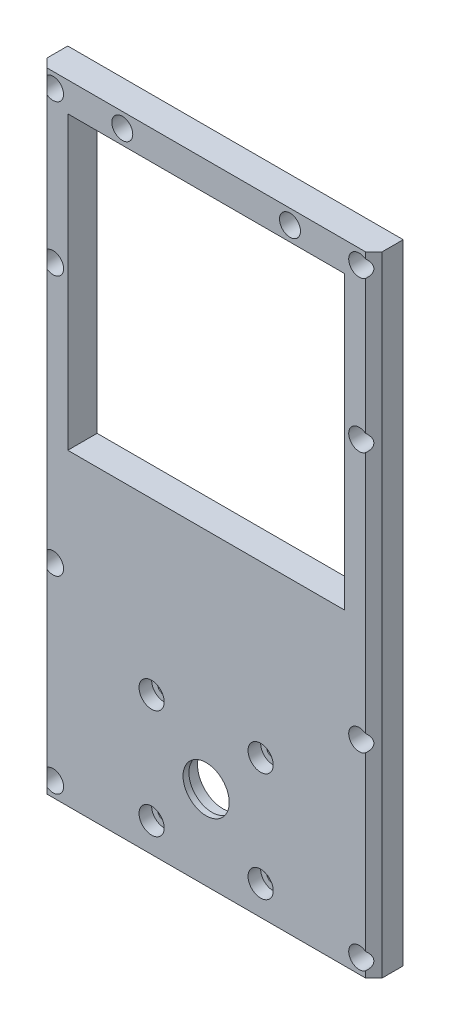
from build123d import *

# Parameters (mm, degrees)
SKETCH1_W           = 80
SKETCH1_H           = 150
SKETCH1_W_2         = 66
SKETCH1_H_2         = 136
BOSS_EXTRUDE1_DEPTH = 7
SKETCH2_W           = 66
SKETCH2_H           = 36
BOSS_EXTRUDE2_DEPTH = 7
SKETCH3_R           = 5.5
CUT_EXTRUDE1_DEPTH  = 86.287748241
SKETCH4_R           = 6.05
CUT_EXTRUDE2_DEPTH  = 5.6
SKETCH5_R           = 11
CUT_EXTRUDE3_DEPTH  = 3
SKETCH6_R           = 1.6
CUT_EXTRUDE4_DEPTH  = 86.287748241
SKETCH7_W           = 50
SKETCH7_H           = 38
CUT_EXTRUDE5_DEPTH  = 1
SKETCH8_R           = 3
CUT_EXTRUDE6_DEPTH  = 3
SKETCH9_R           = 1.35
CUT_EXTRUDE7_DEPTH  = 86.287748241
SKETCH10_R          = 2.5
CUT_EXTRUDE8_DEPTH  = 5
CHAMFER1_SIZE       = 2
SKETCH11_W          = 66
SKETCH11_H          = 30.5
BOSS_EXTRUDE3_DEPTH = 7
SKETCH12_R          = 1.35
CUT_EXTRUDE9_DEPTH  = 86.287748241
SKETCH13_R          = 2.5
CUT_EXTRUDE10_DEPTH = 5


with BuildPart() as part:
    # Sketch1 → Boss-Extrude1 (new body)
    with BuildSketch(Plane.XY):
        Rectangle(SKETCH1_W, SKETCH1_H)
        Rectangle(SKETCH1_W_2, SKETCH1_H_2, mode=Mode.SUBTRACT)
    extrude(amount=BOSS_EXTRUDE1_DEPTH)

    # Sketch2 → Boss-Extrude2 (add)
    with BuildSketch(Plane.XY.offset(7)):
        with Locations((0, -50)):
            Rectangle(SKETCH2_W, SKETCH2_H)
    extrude(amount=-BOSS_EXTRUDE2_DEPTH)

    # Sketch3 → Cut-Extrude1 (cut, through all)
    with BuildSketch(Plane(origin=(0, 0, 0), x_dir=(-1, 0, 0), z_dir=(0, 0, -1))):
        with Locations((0, -55)):
            Circle(SKETCH3_R)
    extrude(amount=-CUT_EXTRUDE1_DEPTH, mode=Mode.SUBTRACT)

    # Sketch4 → Cut-Extrude2 (cut)
    with BuildSketch(Plane(origin=(0, 0, 0), x_dir=(-1, 0, 0), z_dir=(0, 0, -1))):
        with Locations((0, -55)):
            Circle(SKETCH4_R)
    extrude(amount=-CUT_EXTRUDE2_DEPTH, mode=Mode.SUBTRACT)

    # Sketch5 → Cut-Extrude3 (cut)
    with BuildSketch(Plane(origin=(0, 0, 0), x_dir=(-1, 0, 0), z_dir=(0, 0, -1))):
        with Locations((0, -55)):
            Circle(SKETCH5_R)
    extrude(amount=-CUT_EXTRUDE3_DEPTH, mode=Mode.SUBTRACT)

    # Sketch6 → Cut-Extrude4 (cut, through all)
    with BuildSketch(Plane(origin=(0, 0, 0), x_dir=(-1, 0, 0), z_dir=(0, 0, -1))):
        with Locations((-13, -42)):
            Circle(SKETCH6_R)
        with Locations((13, -42)):
            Circle(SKETCH6_R)
        with Locations((13, -68)):
            Circle(SKETCH6_R)
        with Locations((-13, -68)):
            Circle(SKETCH6_R)
    extrude(amount=-CUT_EXTRUDE4_DEPTH, mode=Mode.SUBTRACT)

    # Sketch7 → Cut-Extrude5 (cut)
    with BuildSketch(Plane(origin=(0, 0, 0), x_dir=(-1, 0, 0), z_dir=(0, 0, -1))):
        with Locations((0, -55)):
            Rectangle(SKETCH7_W, SKETCH7_H)
    extrude(amount=-CUT_EXTRUDE5_DEPTH, mode=Mode.SUBTRACT)

    # Sketch8 → Cut-Extrude6 (cut)
    with BuildSketch(Plane.XY.offset(7)):
        with Locations((-13, -42)):
            Circle(SKETCH8_R)
        with Locations((13, -42)):
            Circle(SKETCH8_R)
        with Locations((13, -68)):
            Circle(SKETCH8_R)
        with Locations((-13, -68)):
            Circle(SKETCH8_R)
    extrude(amount=-CUT_EXTRUDE6_DEPTH, mode=Mode.SUBTRACT)

    # Sketch9 → Cut-Extrude7 (cut, through all)
    with BuildSketch(Plane.XY.offset(7)):
        with Locations((-36.5, 71.5)):
            Circle(SKETCH9_R)
        with Locations((36.5, 71.5)):
            Circle(SKETCH9_R)
        with Locations((-36.5, -71.5)):
            Circle(SKETCH9_R)
        with Locations((36.5, -71.5)):
            Circle(SKETCH9_R)
        with Locations((-36.5, 35.5)):
            Circle(SKETCH9_R)
        with Locations((36.5, 35.5)):
            Circle(SKETCH9_R)
        with Locations((36.5, -26.5)):
            Circle(SKETCH9_R)
        with Locations((-36.5, -26.5)):
            Circle(SKETCH9_R)
    extrude(amount=-CUT_EXTRUDE7_DEPTH, mode=Mode.SUBTRACT)

    # Sketch10 → Cut-Extrude8 (cut)
    with BuildSketch(Plane.XY.offset(7)):
        with Locations((-36.5, 71.5)):
            Circle(SKETCH10_R)
        with Locations((36.5, 35.5)):
            Circle(SKETCH10_R)
        with Locations((-36.5, 35.5)):
            Circle(SKETCH10_R)
        with Locations((36.5, 71.5)):
            Circle(SKETCH10_R)
        with Locations((-36.5, -71.5)):
            Circle(SKETCH10_R)
        with Locations((36.5, -71.5)):
            Circle(SKETCH10_R)
        with Locations((-36.5, -26.5)):
            Circle(SKETCH10_R)
        with Locations((36.5, -26.5)):
            Circle(SKETCH10_R)
    extrude(amount=-CUT_EXTRUDE8_DEPTH, mode=Mode.SUBTRACT)

    # Chamfer1
    # the kernel refuses this chamfer: 2 mm, written as the material it takes off along each edge
    with BuildSketch(Plane(origin=(-40, 80.143365976, 7), x_dir=(-0.027495876610585623, 0, -0.9996219169112968), z_dir=(0, -1, 0)), Plane(origin=(40, -80.143365976, 7), x_dir=(0.027495876610585623, 0, -0.9996219169112968), z_dir=(0, 1, 0))) as chamfer1_piece_1:
        Polygon((CHAMFER1_SIZE * 0.999621916911, CHAMFER1_SIZE * 0.0274958766106), (-CHAMFER1_SIZE * 0.0274958766106, CHAMFER1_SIZE * 0.999621916911), (0, 0), align=None)
    extrude(amount=160.286731952, mode=Mode.SUBTRACT)

    # Sketch11 → Boss-Extrude3 (add)
    with BuildSketch(Plane.XY.offset(7)):
        with Locations((0, -16.75)):
            Rectangle(SKETCH11_W, SKETCH11_H)
    extrude(amount=-BOSS_EXTRUDE3_DEPTH)

    # Sketch12 → Cut-Extrude9 (cut, through all)
    with BuildSketch(Plane.XY.offset(7)):
        with Locations((-20, 71.5)):
            Circle(SKETCH12_R)
        with Locations((20, 71.5)):
            Circle(SKETCH12_R)
    extrude(amount=-CUT_EXTRUDE9_DEPTH, mode=Mode.SUBTRACT)

    # Sketch13 → Cut-Extrude10 (cut)
    with BuildSketch(Plane.XY.offset(7)):
        with Locations((-20, 71.5)):
            Circle(SKETCH13_R)
        with Locations((20, 71.5)):
            Circle(SKETCH13_R)
    extrude(amount=-CUT_EXTRUDE10_DEPTH, mode=Mode.SUBTRACT)


solid = part.part
